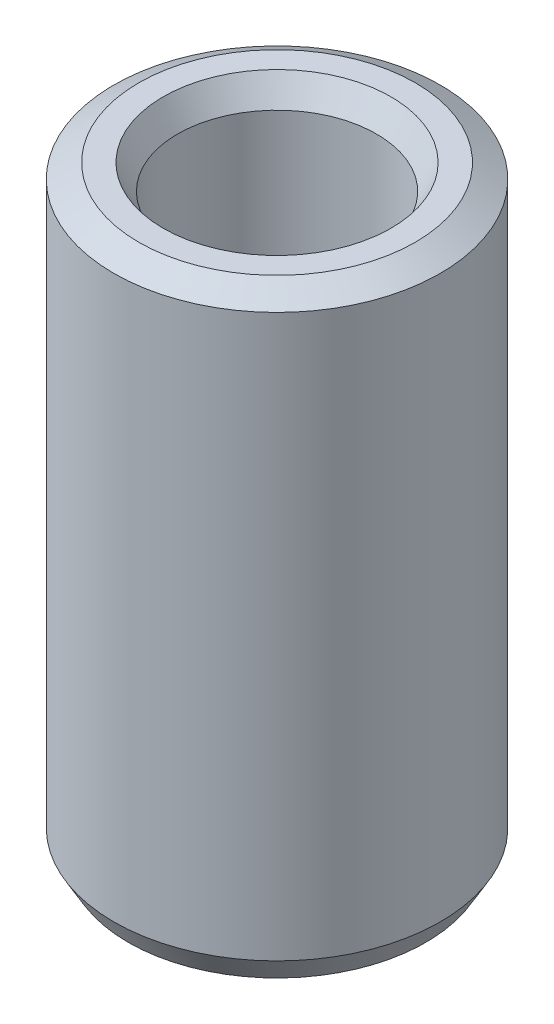
from build123d import *
from OCP.BRepFilletAPI import BRepFilletAPI_MakeChamfer

# Parameters (mm, degrees)
SKETCH1_R           = 10
BOSS_EXTRUDE1_DEPTH = 36.828255913
SKETCH2_R           = 6.09526601
CUT_EXTRUDE1_DEPTH  = 40.450227295
CHAMFER1_SIZE       = 0.884479265
CHAMFER1_SIZE2      = 1.531963026


with BuildPart() as part:
    # Sketch1 → Boss-Extrude1 (new body)
    with BuildSketch(Plane(origin=(0, 0, 0), x_dir=(1, 0, 0), z_dir=(0, 1, 0))):
        Circle(SKETCH1_R)
    extrude(amount=BOSS_EXTRUDE1_DEPTH)

    # Sketch2 → Cut-Extrude1 (cut, through all)
    with BuildSketch(Plane(origin=(0, 0, 0), x_dir=(1, 0, 0), z_dir=(0, 1, 0))):
        Circle(SKETCH2_R)
    extrude(amount=CUT_EXTRUDE1_DEPTH, mode=Mode.SUBTRACT)

    # Chamfer1: one chamfer whose edges measure the first distance from different faces: ONE call of the kernel's chamfer builder (chamfer() names one face for all edges)
    chamfer1_edges_1 = [part.edges().sort_by_distance(p)[0] for p in [
        (-6.09526601, 36.828255913, 0),
    ]]
    chamfer1_side_1 = [part.faces().sort_by_distance(p)[0] for p in [
        (-9.717157288, 36.828255913, 0),
    ]]
    chamfer1_edges_2 = [part.edges().sort_by_distance(p)[0] for p in [
        (-6.09526601, 0, 0),
    ]]
    chamfer1_side_2 = [part.faces().sort_by_distance(p)[0] for p in [
        (-6.09526601, 18.414127957, 0),
    ]]
    chamfer1_edges_3 = [part.edges().sort_by_distance(p)[0] for p in [
        (-10, 0, 0),
    ]]
    chamfer1_side_3 = [part.faces().sort_by_distance(p)[0] for p in [
        (-9.717157288, 0, 0),
    ]]
    chamfer1_edges_4 = [part.edges().sort_by_distance(p)[0] for p in [
        (-10, 36.828255913, 0),
    ]]
    chamfer1_side_4 = [part.faces().sort_by_distance(p)[0] for p in [
        (-10, 18.414127957, 0),
    ]]
    chamfer1 = BRepFilletAPI_MakeChamfer(part.part.solid().wrapped)
    for e in chamfer1_edges_1:
        chamfer1.Add(CHAMFER1_SIZE, CHAMFER1_SIZE2, e.wrapped, chamfer1_side_1[0].wrapped)  # the first distance lies on this face
    for e in chamfer1_edges_2:
        chamfer1.Add(CHAMFER1_SIZE, CHAMFER1_SIZE2, e.wrapped, chamfer1_side_2[0].wrapped)  # the first distance lies on this face
    for e in chamfer1_edges_3:
        chamfer1.Add(CHAMFER1_SIZE, CHAMFER1_SIZE2, e.wrapped, chamfer1_side_3[0].wrapped)  # the first distance lies on this face
    for e in chamfer1_edges_4:
        chamfer1.Add(CHAMFER1_SIZE, CHAMFER1_SIZE2, e.wrapped, chamfer1_side_4[0].wrapped)  # the first distance lies on this face
    add(Compound.cast(chamfer1.Shape()), mode=Mode.REPLACE)


solid = part.part
